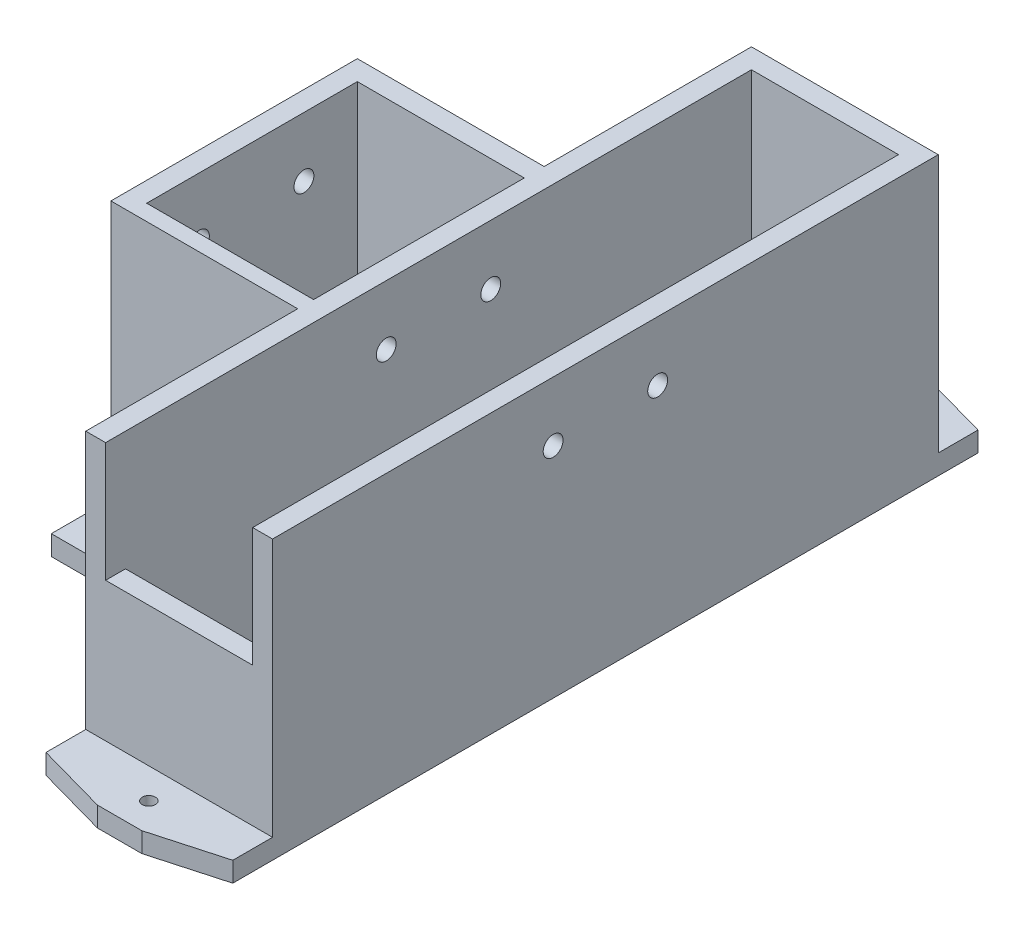
from build123d import *
from OCP.BRepFilletAPI import BRepFilletAPI_MakeChamfer

# Parameters (mm, degrees)
RESSALTO_EXTRUS_O1_DEPTH = 70
ESBO_O3_W                = 37
ESBO_O3_H                = 157.5
CORTE_EXTRUS_O2_DEPTH    = 65
ESBO_O5_W                = 37
ESBO_O5_H                = 31.934482306
CORTE_EXTRUS_O3_DEPTH    = 30
ESBO_O11_W               = 47
ESBO_O11_H               = 15
RESSALTO_EXTRUS_O2_DEPTH = 5
ESBO_O12_R               = 1.65
CORTE_EXTRUS_O6_DEPTH    = 138.647420971
ESBO_O14_R               = 2.5
CORTE_EXTRUS_O8_DEPTH    = 154.256525147
ESBO_O15_W               = 42
ESBO_O15_H               = 53
CORTE_EXTRUS_O10_DEPTH   = 65
CHANFRO9_SIZE            = 5
CHANFRO9_SIZE2           = 17.907987678


with BuildPart() as part:
    # Esboço1 → Ressalto-extrusão1 (new body)
    with BuildSketch(Plane(origin=(0, 0, 0), x_dir=(1, 0, 0), z_dir=(0, 1, 0))):
        Polygon((23.5, 83.75), (-23.5, 83.75), (-23.5, 31.585067636), (-70.5, 31.585067636), (-70.5, -30.414932364), (-23.5, -30.414932364), (-23.5, -83.75), (23.5, -83.75), align=None)
    extrude(amount=RESSALTO_EXTRUS_O1_DEPTH)

    # Esboço3 → Corte-extrusão2 (cut)
    with BuildSketch(Plane(origin=(0, 70, 0), x_dir=(1, 0, 0), z_dir=(0, 1, 0))):
        Rectangle(ESBO_O3_W, ESBO_O3_H)
    extrude(amount=-CORTE_EXTRUS_O2_DEPTH, mode=Mode.SUBTRACT)

    # Esboço5 → Corte-extrusão3 (cut)
    with BuildSketch(Plane(origin=(0, 70, 0), x_dir=(1, 0, 0), z_dir=(0, 1, 0))):
        with Locations((0, -78.75)):
            Rectangle(ESBO_O5_W, ESBO_O5_H)
    extrude(amount=-CORTE_EXTRUS_O3_DEPTH, mode=Mode.SUBTRACT)

    # Esboço11 → Ressalto-extrusão2 (add)
    with BuildSketch(Plane.XZ):
        with Locations((0, -91.25)):
            Rectangle(ESBO_O11_W, ESBO_O11_H)
        with Locations((0, 91.25)):
            Rectangle(ESBO_O11_W, ESBO_O11_H)
        with Locations((-47, -39.085067636)):
            Rectangle(ESBO_O11_W, ESBO_O11_H)
        with Locations((-47, 37.914932364)):
            Rectangle(ESBO_O11_W, ESBO_O11_H)
    extrude(amount=-RESSALTO_EXTRUS_O2_DEPTH)

    # Esboço12 → Corte-extrusão6 (cut, through all)
    with BuildSketch(Plane(origin=(0, 5, 0), x_dir=(1, 0, 0), z_dir=(0, 1, 0))):
        with Locations((-47, -38.049932364)):
            Circle(ESBO_O12_R)
        with Locations((-47, 39.215067636)):
            Circle(ESBO_O12_R)
        with Locations((0, -91.38)):
            Circle(ESBO_O12_R)
        with Locations((0, 91.38)):
            Circle(ESBO_O12_R)
    extrude(amount=-CORTE_EXTRUS_O6_DEPTH, mode=Mode.SUBTRACT)

    # Esboço14 → Corte-extrusão8 (cut, through all)
    with BuildSketch(Plane(origin=(23.5, 0, 0), x_dir=(0, 0, -1), z_dir=(1, 0, 0))):
        with Locations((-13.15, 55)):
            Circle(ESBO_O14_R)
        with Locations((13.15, 55)):
            Circle(ESBO_O14_R)
    extrude(amount=-CORTE_EXTRUS_O8_DEPTH, mode=Mode.SUBTRACT)

    # Esboço15 → Corte-extrusão10 (cut)
    with BuildSketch(Plane(origin=(0, 70, 0), x_dir=(1, 0, 0), z_dir=(0, 1, 0))):
        with Locations((-44.5, 0.085067636)):
            Rectangle(ESBO_O15_W, ESBO_O15_H)
    extrude(amount=-CORTE_EXTRUS_O10_DEPTH, mode=Mode.SUBTRACT)

    # Chanfro9: one chamfer whose edges measure the first distance from different faces: ONE call of the kernel's chamfer builder (chamfer() names one face for all edges)
    chanfro9_edges_1 = [part.edges().sort_by_distance(p)[0] for p in [
        (23.5, 2.5, 98.75),
        (23.5, 2.5, -98.75),
    ]]
    chanfro9_side_1 = [part.faces().sort_by_distance(p)[0] for p in [
        (23.5, 34.521753359, 0),
    ]]
    chanfro9_edges_2 = [part.edges().sort_by_distance(p)[0] for p in [
        (-23.5, 2.5, 98.75),
    ]]
    chanfro9_side_2 = [part.faces().sort_by_distance(p)[0] for p in [
        (-23.5, 35, 58.153894753),
    ]]
    chanfro9_edges_3 = [part.edges().sort_by_distance(p)[0] for p in [
        (-23.5, 2.5, -98.75),
    ]]
    chanfro9_side_3 = [part.faces().sort_by_distance(p)[0] for p in [
        (-23.5, 35, -58.73896239),
    ]]
    chanfro9 = BRepFilletAPI_MakeChamfer(part.part.solid().wrapped)
    for e in chanfro9_edges_1:
        chanfro9.Add(CHANFRO9_SIZE, CHANFRO9_SIZE2, e.wrapped, chanfro9_side_1[0].wrapped)  # the first distance lies on this face
    for e in chanfro9_edges_2:
        chanfro9.Add(CHANFRO9_SIZE, CHANFRO9_SIZE2, e.wrapped, chanfro9_side_2[0].wrapped)  # the first distance lies on this face
    for e in chanfro9_edges_3:
        chanfro9.Add(CHANFRO9_SIZE, CHANFRO9_SIZE2, e.wrapped, chanfro9_side_3[0].wrapped)  # the first distance lies on this face
    add(Compound.cast(chanfro9.Shape()), mode=Mode.REPLACE)


solid = part.part
